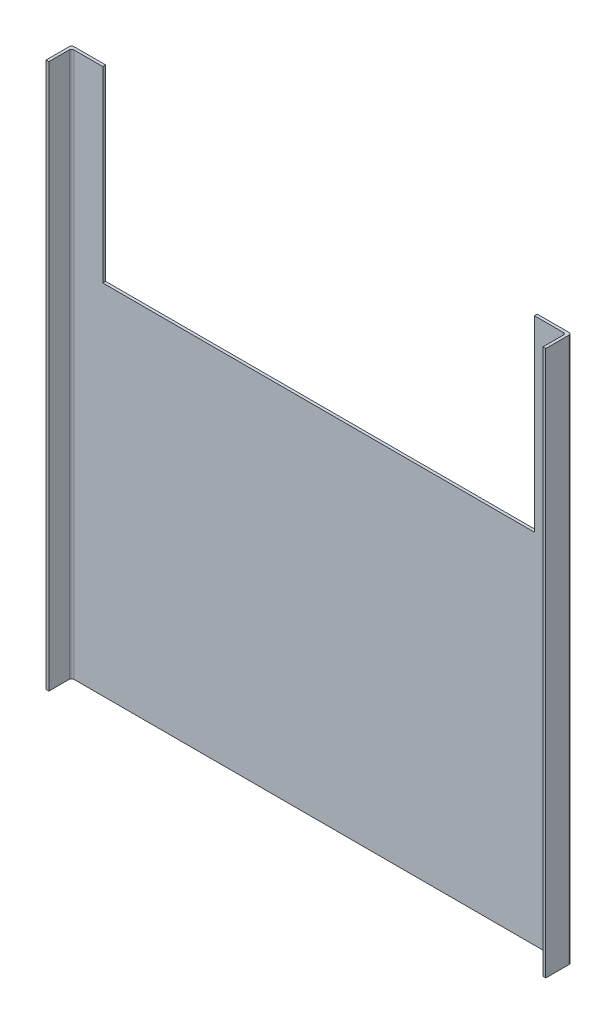
from build123d import *

# Parameters (mm, degrees)
BOSS_EXTRUDE1_DEPTH = 6.35
SKETCH2_W           = 6.35
SKETCH2_H           = 1219.2
BOSS_EXTRUDE2_DEPTH = 50.8
FILLET1_R           = 5


with BuildPart() as part:
    # Sketch1 → Boss-Extrude1 (new body)
    with BuildSketch(Plane.XY):
        Polygon((1041.4, 1219.2), (1117.6, 1219.2), (1117.6, 0), (0, 0), (0, 1219.2), (76.2, 1219.2), (76.2, 800), (1041.4, 800), align=None)
    extrude(amount=BOSS_EXTRUDE1_DEPTH)

    # Sketch2 → Boss-Extrude2 (add)
    with BuildSketch(Plane.XY.offset(6.35)):
        with Locations((3.175, 609.6)):
            Rectangle(SKETCH2_W, SKETCH2_H)
        with Locations((1114.425, 609.6)):
            Rectangle(SKETCH2_W, SKETCH2_H)
    extrude(amount=BOSS_EXTRUDE2_DEPTH)

    # Fillet1
    fillet1_edges = [part.edges().sort_by_distance(p)[0] for p in [
        (1117.6, 609.6, 0),
        (0, 609.6, 0),
        (1111.25, 609.6, 6.35),
        (6.35, 609.6, 6.35),
    ]]
    fillet(fillet1_edges, radius=FILLET1_R)


solid = part.part
